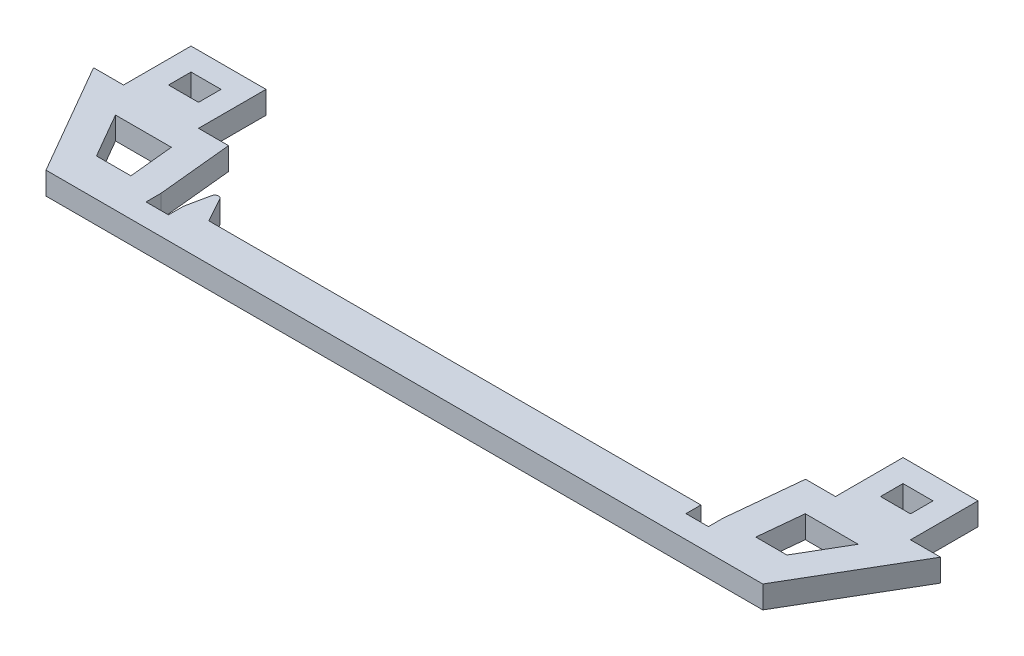
from build123d import *

# Parameters (mm, degrees)
SKETCH1_W           = 4
SKETCH1_H           = 3
BOSS_EXTRUDE1_DEPTH = 3


with BuildPart() as part:
    # Sketch1 → Boss-Extrude1 (new body)
    with BuildSketch(Plane(origin=(0, 0, 0), x_dir=(1, 0, 0), z_dir=(0, 1, 0))):
        with BuildLine():
            Line((-62.418566214, -47.1586621), (-58.418566214, -47.1586621))
            Line((-58.418566214, -47.1586621), (-58.418566214, -38.1586621))
            Line((-58.418566214, -38.1586621), (-48.418566214, -38.1586621))
            Line((-48.418566214, -38.1586621), (-48.418566214, -47.1586621))
            Line((-48.418566214, -47.1586621), (-44.418566214, -47.1586621))
            Line((-44.418566214, -47.1586621), (-43.418817081, -57.156153425))
            Line((-43.418817081, -57.156153425), (-43.418817081, -59.1586621))
            Line((-43.418817081, -59.1586621), (-40.418817081, -59.1586621))
            Line((-40.418817081, -59.1586621), (-40.418817081, -57.1586621))
            Line((-40.418817081, -57.1586621), (-39.768314985, -54.040900504))
            ThreePointArc((-39.768314985, -54.040900504), (-39.353561489, -53.648635874), (-38.841423204, -53.900838924))
            Line((-38.841423204, -53.900838924), (-37.03772781, -57.1586621))
            Line((-37.03772781, -57.1586621), (28.581433786, -57.1586621))
            Line((28.581433786, -57.1586621), (28.581433786, -59.1586621))
            Line((28.581433786, -59.1586621), (31.581433786, -59.1586621))
            Line((31.581433786, -59.1586621), (31.581433786, -57.208800497))
            Line((31.581433786, -57.208800497), (32.581433786, -47.211334262))
            Line((32.581433786, -47.211334262), (36.581433786, -47.211334262))
            Line((36.581433786, -47.211334262), (36.581433786, -38.211334262))
            Line((36.581433786, -38.211334262), (46.581433786, -38.211334262))
            Line((46.581433786, -38.211334262), (46.581433786, -47.211334262))
            Line((46.581433786, -47.211334262), (50.581433786, -47.211334262))
            Line((50.581433786, -47.211334262), (41.830582941, -62.1586621))
            Line((41.830582941, -62.1586621), (-53.758312176, -62.1586621))
            Line((-53.758312176, -62.1586621), (-62.418566214, -47.1586621))
        make_face()
        Polygon((36.547763079, -51.211334262), (43.604572315, -51.211334262), (40.093380681, -57.208800497), (35.947864455, -57.208800497), align=None, mode=Mode.SUBTRACT)
        with Locations((-53.418566214, -42.6586621)):
            Rectangle(SKETCH1_W, SKETCH1_H, mode=Mode.SUBTRACT)
        with Locations((41.581433786, -42.711334262)):
            Rectangle(SKETCH1_W, SKETCH1_H, mode=Mode.SUBTRACT)
        Polygon((-55.490362984, -51.1586621), (-48.038516462, -51.1586621), (-47.438516462, -57.1586621), (-52.026261368, -57.1586621), align=None, mode=Mode.SUBTRACT)
    extrude(amount=BOSS_EXTRUDE1_DEPTH)


solid = part.part
